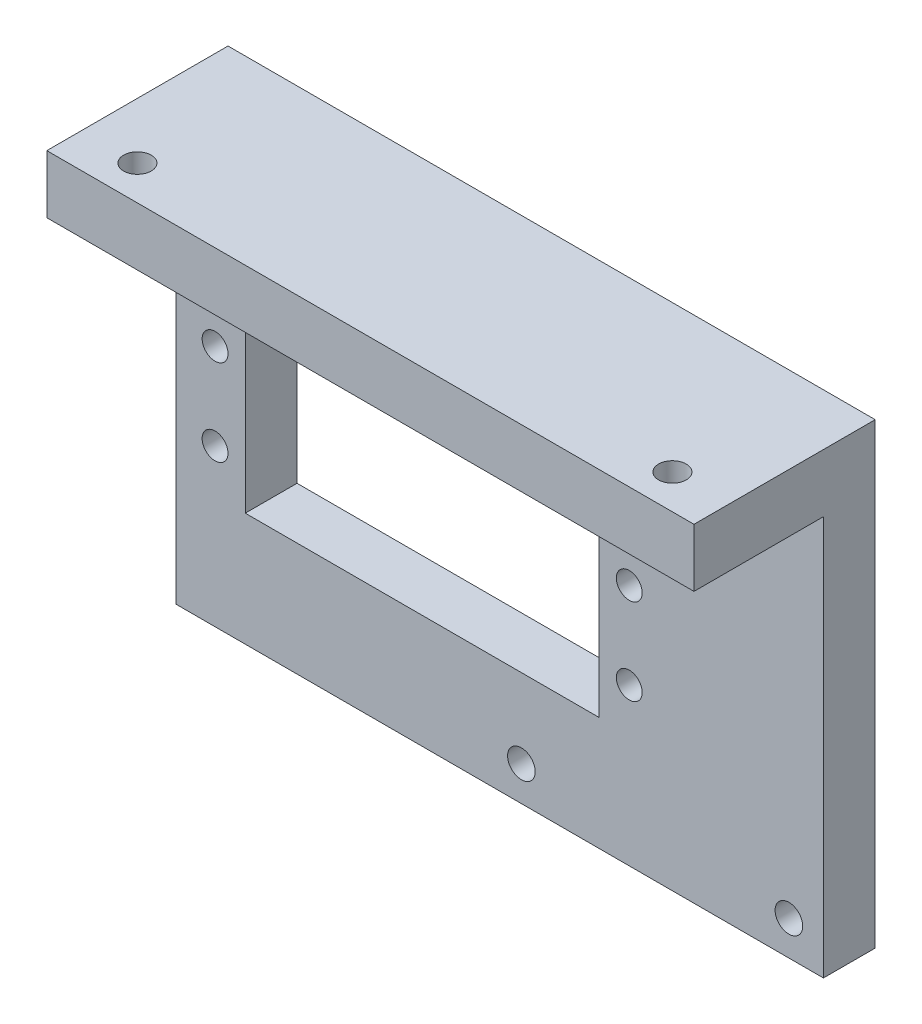
from build123d import *

# Parameters (mm, degrees)
SKETCH1_W           = 75
SKETCH1_H           = 46.3
SKETCH1_R           = 1.5
SKETCH1_W_2         = 41
SKETCH1_H_2         = 20
BASE_FLANGE2_DEPTH  = 6
EDGE_FLANGE1_DEPTH  = 75
CUT_EXTRUDE1_REACH  = 74.112
SKETCH15_R          = 1.6
CUT_EXTRUDE2_REACH  = 61.131
SKETCH16_R          = 1.6
SKETCH17_W          = 75
SKETCH17_H          = 21
BOSS_EXTRUDE1_DEPTH = 6.7366
CUT_EXTRUDE3_REACH  = 74.112
SKETCH18_R          = 1.6


# Sheet-metal steps are written as plain solids
with BuildPart() as part:
    # Sketch1 → Base-Flange2 (new body)
    with BuildSketch(Plane.XY):
        with Locations((9, 0)):
            Rectangle(SKETCH1_W, SKETCH1_H)
        with Locations((-24, 5)):
            Circle(SKETCH1_R, mode=Mode.SUBTRACT)
        with Locations(Location((24, 5, 0), (0, 0, 180))):
            Circle(SKETCH1_R, mode=Mode.SUBTRACT)
        with Locations((24, -5)):
            Circle(SKETCH1_R, mode=Mode.SUBTRACT)
        with Locations(Location((-24, -5, 0), (0, 0, 180))):
            Circle(SKETCH1_R, mode=Mode.SUBTRACT)
        Rectangle(SKETCH1_W_2, SKETCH1_H_2, mode=Mode.SUBTRACT)
    extrude(amount=-BASE_FLANGE2_DEPTH)

    # Edge-Flange1 section (across the edge) → Edge-Flange1 (add)
    with BuildSketch(Plane(origin=(46.5, 23.8866, 0), x_dir=(0, -1, 0), z_dir=(-1, 0, 0))):
        with BuildLine():
            Line((-6, 0.7366), (-6, 15))
            Line((-6, 15), (0, 15))
            Line((0, 15), (0, 0.7366))
            ThreePointArc((0, 0.7366), (0.215745145, 0.215745145), (0.7366, 0))
            Line((0.7366, 0), (0.7366, -6))
            ThreePointArc((0.7366, -6), (-4.026895542, -4.026895542), (-6, 0.7366))
        make_face()
    extrude(amount=EDGE_FLANGE1_DEPTH)

    # Sketch15 → Cut-Extrude1 (cut, up to next)
    with BuildSketch(Plane(origin=(0, 29.8866, 0), x_dir=(1, 0, 0), z_dir=(0, 1, 0)), mode=Mode.PRIVATE) as cut_extrude1_sk1:
        with Locations(Location((-22, -11, 0), (0, 0, 270))):
            Circle(SKETCH15_R)
    cut_extrude1_tool1 = extrude(cut_extrude1_sk1.sketch, amount=-CUT_EXTRUDE1_REACH, mode=Mode.PRIVATE) & part.part
    # Sketch15 → Cut-Extrude1 (cut, up to next)
    with BuildSketch(Plane(origin=(0, 29.8866, 0), x_dir=(1, 0, 0), z_dir=(0, 1, 0)), mode=Mode.PRIVATE) as cut_extrude1_sk2:
        with Locations(Location((40, -11, 0), (0, 0, 90))):
            Circle(SKETCH15_R)
    cut_extrude1_tool2 = extrude(cut_extrude1_sk2.sketch, amount=-CUT_EXTRUDE1_REACH, mode=Mode.PRIVATE) & part.part
    add(cut_extrude1_tool1.solids().sort_by_distance((-22, 29.8866, 11))[0], mode=Mode.SUBTRACT)
    add(cut_extrude1_tool2.solids().sort_by_distance((40, 29.8866, 11))[0], mode=Mode.SUBTRACT)

    # Sketch16 → Cut-Extrude2 (cut, up to next)
    with BuildSketch(Plane(origin=(0, 0, -6), x_dir=(-1, 0, 0), z_dir=(0, 0, -1)), mode=Mode.PRIVATE) as cut_extrude2_sk1:
        with Locations((-42.5, -19.15)):
            Circle(SKETCH16_R)
    cut_extrude2_tool1 = extrude(cut_extrude2_sk1.sketch, amount=-CUT_EXTRUDE2_REACH, mode=Mode.PRIVATE) & part.part
    # Sketch16 → Cut-Extrude2 (cut, up to next)
    with BuildSketch(Plane(origin=(0, 0, -6), x_dir=(-1, 0, 0), z_dir=(0, 0, -1)), mode=Mode.PRIVATE) as cut_extrude2_sk2:
        with Locations((-11.5, -19.15)):
            Circle(SKETCH16_R)
    cut_extrude2_tool2 = extrude(cut_extrude2_sk2.sketch, amount=-CUT_EXTRUDE2_REACH, mode=Mode.PRIVATE) & part.part
    add(cut_extrude2_tool1.solids().sort_by_distance((42.5, -19.15, -6))[0], mode=Mode.SUBTRACT)
    add(cut_extrude2_tool2.solids().sort_by_distance((11.5, -19.15, -6))[0], mode=Mode.SUBTRACT)

    # Sketch17 → Boss-Extrude1 (add)
    with BuildSketch(Plane(origin=(0, 29.8866, 0), x_dir=(1, 0, 0), z_dir=(0, 1, 0))):
        with Locations((9, -4.5)):
            Rectangle(SKETCH17_W, SKETCH17_H)
    extrude(amount=-BOSS_EXTRUDE1_DEPTH)

    # Sketch18 → Cut-Extrude3 (cut, up to next)
    with BuildSketch(Plane(origin=(0, 29.8866, 0), x_dir=(1, 0, 0), z_dir=(0, 1, 0)), mode=Mode.PRIVATE) as cut_extrude3_sk1:
        with Locations(Location((-22, -11, 0), (0, 0, 270))):
            Circle(SKETCH18_R)
    cut_extrude3_tool1 = extrude(cut_extrude3_sk1.sketch, amount=-CUT_EXTRUDE3_REACH, mode=Mode.PRIVATE) & part.part
    # Sketch18 → Cut-Extrude3 (cut, up to next)
    with BuildSketch(Plane(origin=(0, 29.8866, 0), x_dir=(1, 0, 0), z_dir=(0, 1, 0)), mode=Mode.PRIVATE) as cut_extrude3_sk2:
        with Locations(Location((40, -11, 0), (0, 0, 270))):
            Circle(SKETCH18_R)
    cut_extrude3_tool2 = extrude(cut_extrude3_sk2.sketch, amount=-CUT_EXTRUDE3_REACH, mode=Mode.PRIVATE) & part.part
    add(cut_extrude3_tool1.solids().sort_by_distance((-22, 29.8866, 11))[0], mode=Mode.SUBTRACT)
    add(cut_extrude3_tool2.solids().sort_by_distance((40, 29.8866, 11))[0], mode=Mode.SUBTRACT)


solid = part.part
